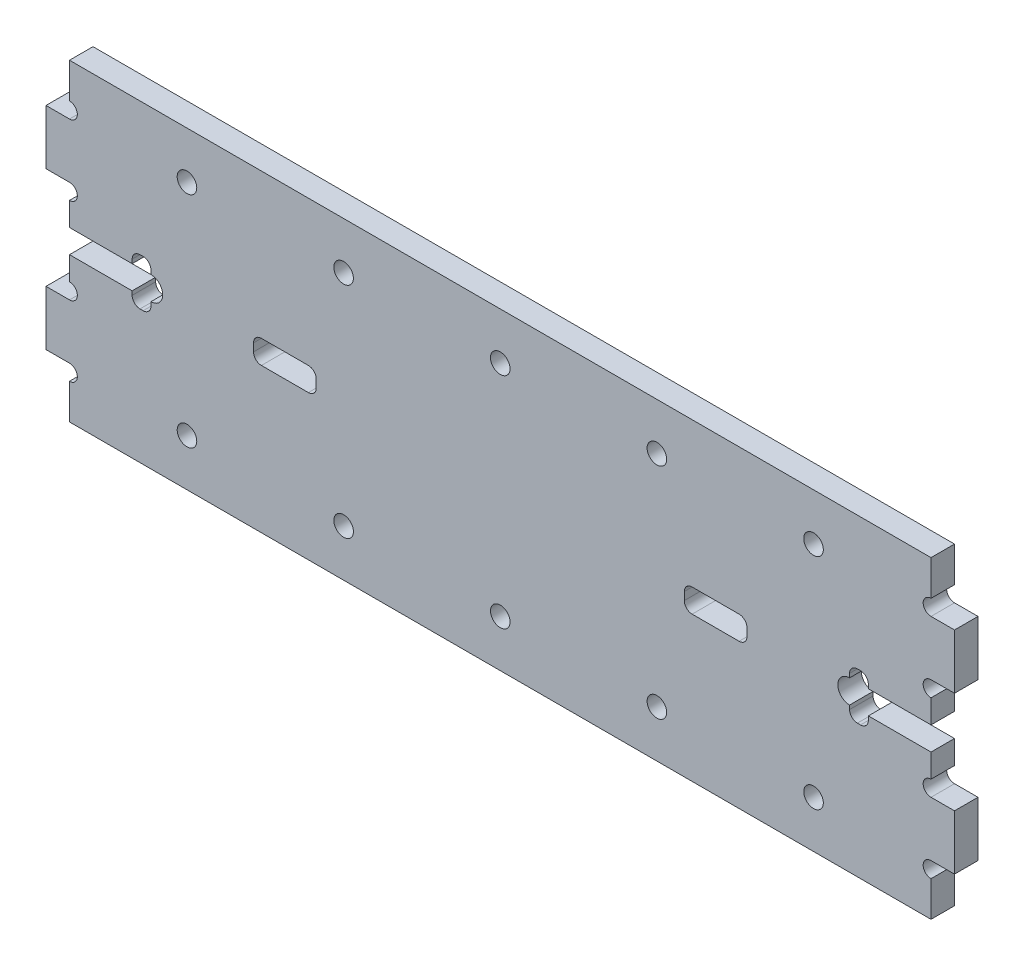
from build123d import *

# Parameters (mm, degrees)
SKETCH1_W           = 110
SKETCH1_H           = 40
BOSS_EXTRUDE1_DEPTH = 3
BOSS_EXTRUDE2_DEPTH = 3
CUT_EXTRUDE1_DEPTH  = 3
CUT_EXTRUDE2_DEPTH  = 3
FILLET6_R           = 1
SKETCH5_W           = 8
SKETCH5_H           = 3
CUT_EXTRUDE3_DEPTH  = 10
FILLET7_R           = 1
SKETCH6_R           = 1.25
CUT_EXTRUDE4_DEPTH  = 62.424750712


with BuildPart() as part:
    # Sketch1 → Boss-Extrude1 (new body)
    with BuildSketch(Plane.XY):
        Rectangle(SKETCH1_W, SKETCH1_H)
    extrude(amount=BOSS_EXTRUDE1_DEPTH)

    # Sketch2 → Boss-Extrude2 (add)
    with BuildSketch(Plane.XY.offset(3)):
        Polygon((58, 10), (58, 13.5), (55, 13.5), (55, 6.5), (58, 6.5), align=None)
        Polygon((55, -10), (55, -6.5), (58, -6.5), (58, -13.5), (55, -13.5), align=None)
        Polygon((-55, 6.5), (-55, 13.5), (-58, 13.5), (-58, 10), (-58, 6.5), align=None)
        Polygon((-55, -13.5), (-55, -10), (-55, -6.5), (-58, -6.5), (-58, -13.5), align=None)
    extrude(amount=-BOSS_EXTRUDE2_DEPTH)

    # Sketch3 → Cut-Extrude1 (cut)
    with BuildSketch(Plane.XY.offset(3)):
        with BuildLine():
            Line((-55, 15.5), (-55, 13.5))
            ThreePointArc((-55, 13.5), (-54, 14.5), (-55, 15.5))
        make_face()
        with BuildLine():
            ThreePointArc((-55, 4.5), (-54, 5.5), (-55, 6.5))
            Line((-55, 6.5), (-55, 4.5))
        make_face()
        with BuildLine():
            ThreePointArc((-55, -6.5), (-54, -5.5), (-55, -4.5))
            Line((-55, -4.5), (-55, -6.5))
        make_face()
        with BuildLine():
            ThreePointArc((-55, -15.5), (-54, -14.5), (-55, -13.5))
            Line((-55, -13.5), (-55, -15.5))
        make_face()
        with BuildLine():
            ThreePointArc((55, 15.5), (54, 14.5), (55, 13.5))
            Line((55, 13.5), (55, 15.5))
        make_face()
        with BuildLine():
            Line((55, -6.5), (55, -4.5))
            ThreePointArc((55, -4.5), (54, -5.5), (55, -6.5))
        make_face()
        with BuildLine():
            Line((55, 4.5), (55, 6.5))
            ThreePointArc((55, 6.5), (54, 5.5), (55, 4.5))
        make_face()
        with BuildLine():
            Line((55, -15.5), (55, -13.5))
            ThreePointArc((55, -13.5), (54, -14.5), (55, -15.5))
        make_face()
    extrude(amount=-CUT_EXTRUDE1_DEPTH, mode=Mode.SUBTRACT)

    # Sketch4 → Cut-Extrude2 (cut)
    with BuildSketch(Plane.XY.offset(3)):
        with BuildLine():
            Line((-47, 1.5), (-55, 1.5))
            Line((-55, 1.5), (-55, -1.5))
            Line((-55, -1.5), (-47, -1.5))
            Line((-47, -1.5), (-47, -3))
            Line((-47, -3), (-44.6, -3))
            Line((-44.6, -3), (-44.6, -1.5))
            ThreePointArc((-44.6, -1.5), (-43.1, 0), (-44.6, 1.5))
            Line((-44.6, 1.5), (-44.6, 3))
            Line((-44.6, 3), (-47, 3))
            Line((-47, 3), (-47, 1.5))
        make_face()
        with BuildLine():
            Line((47, 3), (44.6, 3))
            Line((44.6, 3), (44.6, 1.5))
            ThreePointArc((44.6, 1.5), (43.1, 0), (44.6, -1.5))
            Line((44.6, -1.5), (44.6, -3))
            Line((44.6, -3), (47, -3))
            Line((47, -3), (47, -1.5))
            Line((47, -1.5), (55, -1.5))
            Line((55, -1.5), (55, 1.5))
            Line((55, 1.5), (47, 1.5))
            Line((47, 1.5), (47, 3))
        make_face()
    extrude(amount=-CUT_EXTRUDE2_DEPTH, mode=Mode.SUBTRACT)

    # Fillet6
    fillet6_edges = [part.edges().sort_by_distance(p)[0] for p in [
        (-44.6, 3, 1.5),
        (-47, 3, 1.5),
        (-44.6, -3, 1.5),
        (-47, -3, 1.5),
        (47, 3, 1.5),
        (44.6, 3, 1.5),
        (47, -3, 1.5),
        (44.6, -3, 1.5),
    ]]
    fillet(fillet6_edges, radius=FILLET6_R)

    # Sketch5 → Cut-Extrude3 (cut)
    with BuildSketch(Plane.XY.offset(3)):
        with Locations((-27.5, 0)):
            Rectangle(SKETCH5_W, SKETCH5_H)
        with Locations((27.5, 0)):
            Rectangle(SKETCH5_W, SKETCH5_H)
    extrude(amount=-CUT_EXTRUDE3_DEPTH, mode=Mode.SUBTRACT)

    # Fillet7
    fillet7_edges = [part.edges().sort_by_distance(p)[0] for p in [
        (-31.5, -1.5, 1.5),
        (-31.5, 1.5, 1.5),
        (-23.5, 1.5, 1.5),
        (23.5, -1.5, 1.5),
        (23.5, 1.5, 1.5),
        (31.5, 1.5, 1.5),
        (31.5, -1.5, 1.5),
        (-23.5, -1.5, 1.5),
    ]]
    fillet(fillet7_edges, radius=FILLET7_R)

    # Sketch6 → Cut-Extrude4 (cut, through all)
    with BuildSketch(Plane.XY.offset(3)):
        with Locations((0, 14)):
            Circle(SKETCH6_R)
        with Locations((0, -14)):
            Circle(SKETCH6_R)
        with Locations((20, -14)):
            Circle(SKETCH6_R)
        with Locations((20, 14)):
            Circle(SKETCH6_R)
        with Locations((40, -14)):
            Circle(SKETCH6_R)
        with Locations((40, 14)):
            Circle(SKETCH6_R)
        with Locations((-20, -14)):
            Circle(SKETCH6_R)
        with Locations((-20, 14)):
            Circle(SKETCH6_R)
        with Locations((-40, -14)):
            Circle(SKETCH6_R)
        with Locations((-40, 14)):
            Circle(SKETCH6_R)
    extrude(amount=-CUT_EXTRUDE4_DEPTH, mode=Mode.SUBTRACT)


solid = part.part
